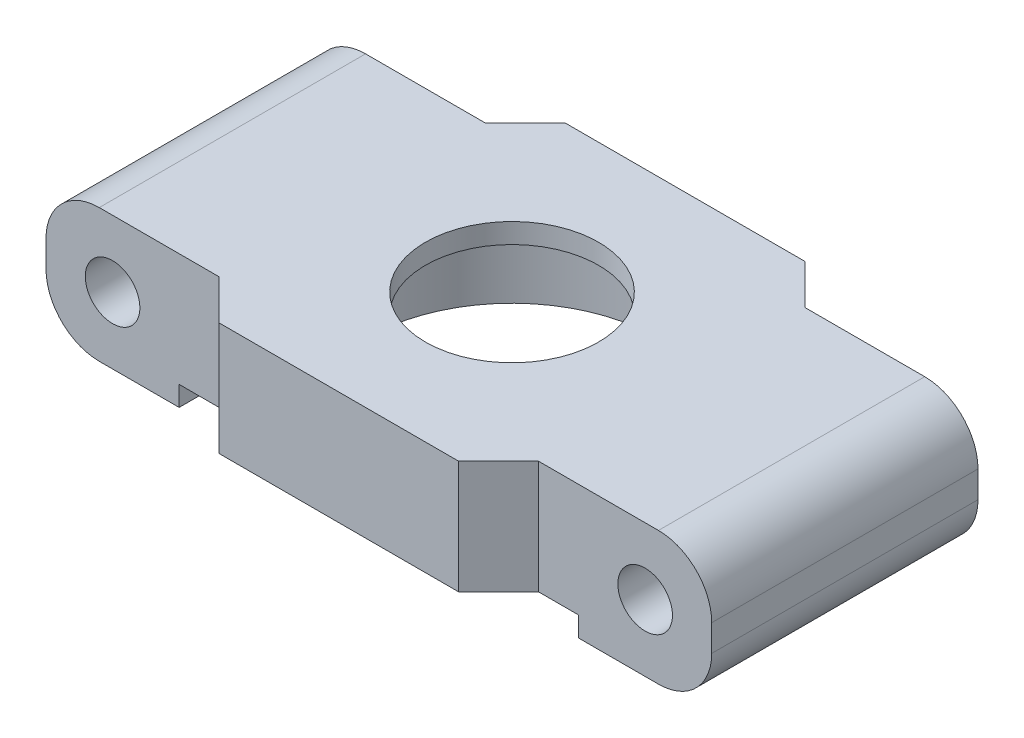
from build123d import *

# Parameters (mm, degrees)
SKETCH1_W           = 30
SKETCH1_H           = 26
SKETCH1_R           = 11
BOSS_EXTRUDE1_DEPTH = 3.5
SKETCH1_3_W         = 10
SKETCH1_3_H         = 20
BOSS_EXTRUDE2_DEPTH = 5
SKETCH2_R           = 2.05
CUT_EXTRUDE1_DEPTH  = 30
FILLET1_R           = 4
CHAMFER1_SIZE       = 6
SKETCH3_R           = 6.5
BOSS_EXTRUDE3_DEPTH = 1.5


with BuildPart() as part:
    # Sketch1 → Boss-Extrude1 (new, symmetric)
    with BuildSketch(Plane(origin=(0, 0, 0), x_dir=(1, 0, 0), z_dir=(0, 1, 0))):
        Rectangle(SKETCH1_W, SKETCH1_H)
        with Locations(Location((0, 0, 0), (0, 0, 270))):
            Circle(SKETCH1_R, mode=Mode.SUBTRACT)
    extrude(amount=BOSS_EXTRUDE1_DEPTH, both=True)

    # Sketch1<3> → Boss-Extrude2 (add, symmetric)
    with BuildSketch(Plane(origin=(0, 0, 0), x_dir=(1, 0, 0), z_dir=(0, 1, 0))):
        with Locations((-20, 0)):
            Rectangle(SKETCH1_3_W, SKETCH1_3_H)
        with Locations((20, 0)):
            Rectangle(SKETCH1_3_W, SKETCH1_3_H)
    extrude(amount=BOSS_EXTRUDE2_DEPTH, both=True)

    # Sketch2 → Cut-Extrude1 (cut)
    with BuildSketch(Plane(origin=(0, 0, -10), x_dir=(-1, 0, 0), z_dir=(0, 0, -1))):
        with Locations((-20, 0)):
            Circle(SKETCH2_R)
        with Locations((20, 0)):
            Circle(SKETCH2_R)
    extrude(amount=-CUT_EXTRUDE1_DEPTH, mode=Mode.SUBTRACT)

    # Fillet1
    fillet1_edges = [part.edges().sort_by_distance(p)[0] for p in [
        (-25, -5, 0),
        (-25, 5, 0),
        (25, 5, 0),
        (25, -5, 0),
    ]]
    fillet(fillet1_edges, radius=FILLET1_R)

    # Chamfer1
    # the kernel refuses this chamfer: 6 mm, written as the material it takes off along each edge
    with BuildSketch(Plane(origin=(15, -18.930097928, -13), x_dir=(0.02749587661058649, 0, 0.9996219169112968), z_dir=(0, 1, 0))) as chamfer1_piece_1_section:
        Polygon((CHAMFER1_SIZE * 0.999621916911, -CHAMFER1_SIZE * 0.0274958766106), (-CHAMFER1_SIZE * 0.0274958766106, -CHAMFER1_SIZE * 0.999621916911), (0, 0), align=None)
    chamfer1_piece_1 = extrude(amount=37.860195856, mode=Mode.PRIVATE)
    chamfer1_piece_1 = split(chamfer1_piece_1, bisect_by=Plane(origin=(12.639593495, 0, -10), z_dir=(0, 0, -1)), keep=Keep.TOP, mode=Mode.PRIVATE)
    add(chamfer1_piece_1, mode=Mode.SUBTRACT)
    with BuildSketch(Plane(origin=(15, 18.930097928, 13), x_dir=(0.02749587661058649, 0, -0.9996219169112968), z_dir=(0, -1, 0))) as chamfer1_piece_2_section:
        Polygon((CHAMFER1_SIZE * 0.999621916911, -CHAMFER1_SIZE * 0.0274958766106), (-CHAMFER1_SIZE * 0.0274958766106, -CHAMFER1_SIZE * 0.999621916911), (0, 0), align=None)
    chamfer1_piece_2 = extrude(amount=37.860195856, mode=Mode.PRIVATE)
    chamfer1_piece_2 = split(chamfer1_piece_2, bisect_by=Plane(origin=(12.639593495, 0, 10), z_dir=(0, 0, 1)), keep=Keep.TOP, mode=Mode.PRIVATE)
    add(chamfer1_piece_2, mode=Mode.SUBTRACT)
    with BuildSketch(Plane(origin=(-15, 18.930097928, 13), x_dir=(0.9996219169112969, 0, 0.02749587661058649), z_dir=(0, -1, 0))) as chamfer1_piece_3_section:
        Polygon((CHAMFER1_SIZE * 0.999621916911, -CHAMFER1_SIZE * 0.0274958766106), (-CHAMFER1_SIZE * 0.0274958766106, -CHAMFER1_SIZE * 0.999621916911), (0, 0), align=None)
    chamfer1_piece_3 = extrude(amount=37.860195856, mode=Mode.PRIVATE)
    chamfer1_piece_3 = split(chamfer1_piece_3, bisect_by=Plane(origin=(-12.639593495, 0, 10), z_dir=(0, 0, 1)), keep=Keep.TOP, mode=Mode.PRIVATE)
    add(chamfer1_piece_3, mode=Mode.SUBTRACT)
    with BuildSketch(Plane(origin=(-15, -18.930097928, -13), x_dir=(0.9996219169112969, 0, -0.02749587661058649), z_dir=(0, 1, 0))) as chamfer1_piece_4_section:
        Polygon((CHAMFER1_SIZE * 0.999621916911, -CHAMFER1_SIZE * 0.0274958766106), (-CHAMFER1_SIZE * 0.0274958766106, -CHAMFER1_SIZE * 0.999621916911), (0, 0), align=None)
    chamfer1_piece_4 = extrude(amount=37.860195856, mode=Mode.PRIVATE)
    chamfer1_piece_4 = split(chamfer1_piece_4, bisect_by=Plane(origin=(-12.639593495, 0, -10), z_dir=(0, 0, -1)), keep=Keep.TOP, mode=Mode.PRIVATE)
    add(chamfer1_piece_4, mode=Mode.SUBTRACT)

    # Sketch3 → Boss-Extrude3 (add)
    with BuildSketch(Plane(origin=(0, 3.5, 0), x_dir=(1, 0, 0), z_dir=(0, 1, 0))):
        Polygon((15, -10), (15, 10), (12, 10), (9, 13), (-9, 13), (-12, 10), (-15, 10), (-15, -10), (-12, -10), (-9, -13), (9, -13), (12, -10), align=None)
        with Locations(Location((0, 0, 0), (0, 0, 270))):
            Circle(SKETCH3_R, mode=Mode.SUBTRACT)
    extrude(amount=BOSS_EXTRUDE3_DEPTH)


solid = part.part
